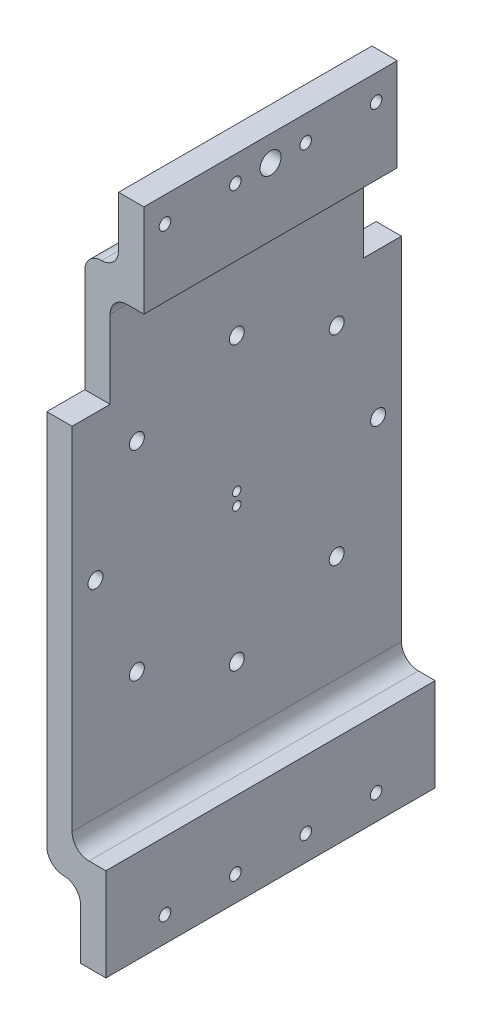
from build123d import *

# Parameters (mm, degrees)
BOSS_EXTRUDE1_DEPTH = 38.1
FILLET1_R           = 5.08
BOSS_EXTRUDE2_DEPTH = 49.53
SKETCH7_R           = 2.25
CUT_EXTRUDE1_DEPTH  = 7.62
SKETCH8_R           = 1.75
CUT_EXTRUDE2_DEPTH  = 7.62
SKETCH10_R          = 3.175
CGTEST1_DEPTH       = 7.62
SKETCH11_R          = 1.27
CUT_EXTRUDE4_DEPTH  = 7.62


with BuildPart() as part:
    # Sketch1 → Boss-Extrude1 (new, symmetric)
    with BuildSketch(Plane.XY):
        Polygon((0, 0), (0, 139.272298857), (10.16, 139.272298857), (10.16, 146.892298857), (10.16, 167.212298857), (2.54, 167.212298857), (2.54, 146.892298857), (-7.62, 146.892298857), (-7.62, 139.272298857), (-7.62, -7.62), (2.54, -7.62), (2.54, -27.94), (10.16, -27.94), (10.16, -7.62), (10.16, 0), align=None)
    extrude(amount=BOSS_EXTRUDE1_DEPTH, both=True)

    # Fillet1
    fillet1_edges = [part.edges().sort_by_distance(p)[0] for p in [
        (0, 0, 0),
        (2.54, -7.62, 0),
        (0, 139.272298857, 0),
        (2.54, 146.892298857, 0),
        (-7.62, 146.892298857, 0),
        (-7.62, -7.62, 0),
    ]]
    fillet(fillet1_edges, radius=FILLET1_R - 0.0001)  # a hair under: the kernel refuses the full size

    # Sketch3 → Boss-Extrude2 (add, symmetric)
    with BuildSketch(Plane(origin=(0, 0, 0), x_dir=(-1, 0, 0), z_dir=(0, 0, -1))):
        with BuildLine():
            Line((0, 110.7), (7.62, 110.7))
            Line((7.62, 110.7), (7.62, -2.54))
            ThreePointArc((7.62, -2.54), (6.132102448, -6.132102448), (2.54, -7.62))
            ThreePointArc((2.54, -7.62), (-1.052102448, -9.107897552), (-2.54, -12.7))
            Line((-2.54, -12.7), (-2.54, -27.94))
            Line((-2.54, -27.94), (-10.16, -27.94))
            Line((-10.16, -27.94), (-10.16, 0))
            Line((-10.16, 0), (-5.08, 0))
            ThreePointArc((-5.08, 0), (-1.487897552, 1.487897552), (0, 5.08))
            Line((0, 5.08), (0, 110.7))
        make_face()
    extrude(amount=BOSS_EXTRUDE2_DEPTH, both=True)

    # Sketch7 → Cut-Extrude1 (cut)
    with BuildSketch(Plane(origin=(0, 0, 0), x_dir=(0, 0, -1), z_dir=(1, 0, 0))):
        with Locations((-42.5, 67.096149428)):
            Circle(SKETCH7_R)
        with Locations((-30.0520382, 97.148187629)):
            Circle(SKETCH7_R)
        with Locations((0, 109.596149428)):
            Circle(SKETCH7_R)
        with Locations((30.0520382, 97.148187629)):
            Circle(SKETCH7_R)
        with Locations((42.5, 67.096149428)):
            Circle(SKETCH7_R)
        with Locations((30.0520382, 37.044111228)):
            Circle(SKETCH7_R)
        with Locations((0, 24.596149428)):
            Circle(SKETCH7_R)
        with Locations((-30.0520382, 37.044111228)):
            Circle(SKETCH7_R)
    extrude(amount=-CUT_EXTRUDE1_DEPTH, mode=Mode.SUBTRACT)

    # Sketch8 → Cut-Extrude2 (cut)
    with BuildSketch(Plane.ZY.offset(-2.54)):
        with Locations(Location((-31.75, 159.592298857, 0), (0, 0, 270))):
            Circle(SKETCH8_R)
        with Locations(Location((-10.583333333, 159.592298857, 0), (0, 0, 270))):
            Circle(SKETCH8_R)
        with Locations(Location((10.583333333, 159.592298857, 0), (0, 0, 270))):
            Circle(SKETCH8_R)
        with Locations(Location((31.75, 159.592298857, 0), (0, 0, 270))):
            Circle(SKETCH8_R)
    cut_extrude2 = extrude(amount=-CUT_EXTRUDE2_DEPTH, mode=Mode.SUBTRACT)

    # Mirror1: Cut-Extrude2 across plane
    add(cut_extrude2.mirror(Plane.ZX.offset(69.636149428)), mode=Mode.SUBTRACT)

    # Sketch10 → CGTest1 (cut)
    with BuildSketch(Plane(origin=(10.16, 0, 0), x_dir=(0, 0, -1), z_dir=(1, 0, 0))):
        with Locations(Location((0, 159.592298857, 0), (0, 0, 90))):
            Circle(SKETCH10_R)
    extrude(amount=-CGTEST1_DEPTH, mode=Mode.SUBTRACT)

    # Sketch11 → Cut-Extrude4 (cut)
    with BuildSketch(Plane.ZY.offset(7.62)):
        with Locations((0, 69.001149428)):
            Circle(SKETCH11_R)
        with Locations((0, 65.191149428)):
            Circle(SKETCH11_R)
    extrude(amount=-CUT_EXTRUDE4_DEPTH, mode=Mode.SUBTRACT)


solid = part.part
